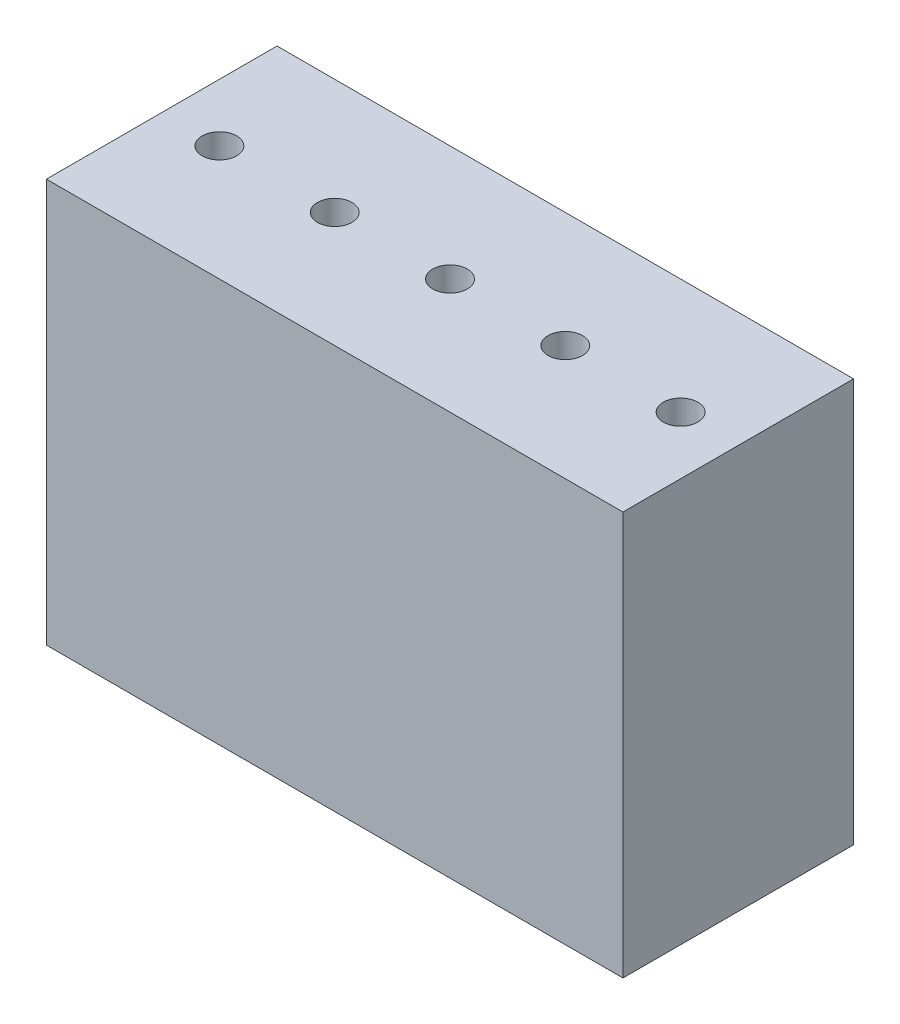
from build123d import *

# Parameters (mm, degrees)
SKETCH1_W           = 50
SKETCH1_H           = 20
SKETCH1_R           = 1.5
BOSS_EXTRUDE1_DEPTH = 35


with BuildPart() as part:
    # Sketch1 → Boss-Extrude1 (new body)
    with BuildSketch(Plane(origin=(0, 0, 0), x_dir=(1, 0, 0), z_dir=(0, 1, 0))):
        with Locations((25, 10)):
            Rectangle(SKETCH1_W, SKETCH1_H)
        with Locations((5, 10)):
            Circle(SKETCH1_R, mode=Mode.SUBTRACT)
        with Locations((15, 10)):
            Circle(SKETCH1_R, mode=Mode.SUBTRACT)
        with Locations((25, 10)):
            Circle(SKETCH1_R, mode=Mode.SUBTRACT)
        with Locations((35, 10)):
            Circle(SKETCH1_R, mode=Mode.SUBTRACT)
        with Locations((45, 10)):
            Circle(SKETCH1_R, mode=Mode.SUBTRACT)
    extrude(amount=BOSS_EXTRUDE1_DEPTH)


solid = part.part
